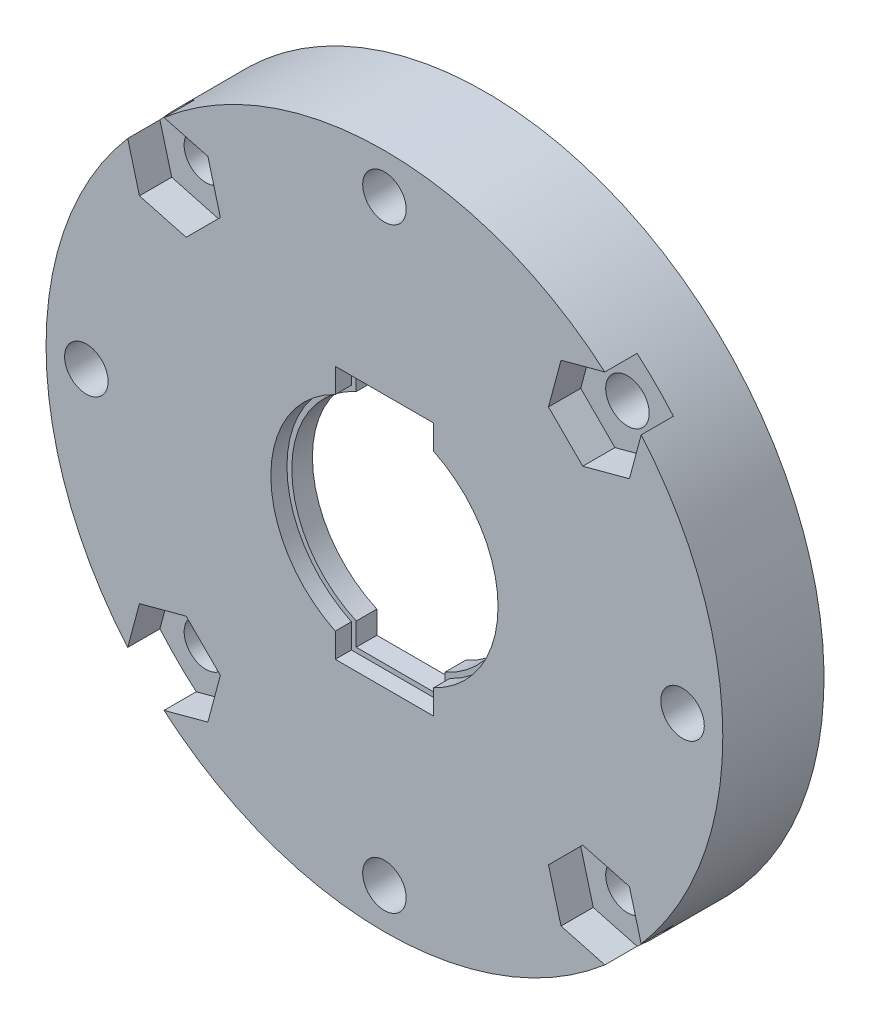
from build123d import *

# Parameters (mm, degrees)
SKETCH3_R           = 21
BOSS_EXTRUDE2_DEPTH = 1
SKETCH4_R           = 21
BOSS_EXTRUDE3_DEPTH = 5.28
SKETCH5_R           = 16.5
CUT_EXTRUDE1_DEPTH  = 4
CUT_EXTRUDE2_DEPTH  = 2
SKETCH8_R           = 1.35
CUT_EXTRUDE4_DEPTH  = 31.355203837
CIRPATTERN1_COUNT   = 4
CIRPATTERN2_COUNT   = 8


with BuildPart() as part:
    # Sketch3 → Boss-Extrude2 (new body)
    with BuildSketch(Plane.XY):
        Circle(SKETCH3_R)
        with BuildLine():
            Line((3.050012, 6.356093675), (3.050012, 7.874431))
            Line((3.050012, 7.874431), (-3.049988, 7.874431))
            Line((-3.049988, 7.874431), (-3.049988, 6.356105191))
            ThreePointArc((-3.049988, 6.356105191), (-7.05, 0), (-3.049988, -6.356105191))
            Line((-3.049988, -6.356105191), (-3.049988, -7.874679))
            Line((-3.049988, -7.874679), (3.050012, -7.874679))
            Line((3.050012, -7.874679), (3.050012, -6.356093675))
            ThreePointArc((3.050012, -6.356093675), (7.05, 0), (3.050012, 6.356093675))
        make_face(mode=Mode.SUBTRACT)
    extrude(amount=-BOSS_EXTRUDE2_DEPTH)

    # Sketch4 → Boss-Extrude3 (add)
    with BuildSketch(Plane(origin=(0, 0, -1), x_dir=(-1, 0, 0), z_dir=(0, 0, -1))):
        Circle(SKETCH4_R)
        with BuildLine():
            Line((2.749988, 6.164419356), (2.749988, 7.574431))
            Line((2.749988, 7.574431), (-2.750012, 7.574431))
            Line((-2.750012, 7.574431), (-2.750012, 6.16440865))
            ThreePointArc((-2.750012, 6.16440865), (-6.75, 0), (-2.750012, -6.16440865))
            Line((-2.750012, -6.16440865), (-2.750012, -7.574679))
            Line((-2.750012, -7.574679), (2.749988, -7.574679))
            Line((2.749988, -7.574679), (2.749988, -6.164419356))
            ThreePointArc((2.749988, -6.164419356), (6.75, 0), (2.749988, 6.164419356))
        make_face(mode=Mode.SUBTRACT)
    extrude(amount=BOSS_EXTRUDE3_DEPTH)

    # Sketch5 → Cut-Extrude1 (cut)
    with BuildSketch(Plane(origin=(0, 0, -6.28), x_dir=(-1, 0, 0), z_dir=(0, 0, -1))):
        Circle(SKETCH5_R)
    extrude(amount=-CUT_EXTRUDE1_DEPTH, mode=Mode.SUBTRACT)

    # Sketch6 → Cut-Extrude2 (cut)
    with BuildSketch(Plane.XY):
        Polygon((13.858507528, 15.981398638), (10.958584342, 15.204366562), (10.181552266, 12.304443376), (12.304443376, 10.181552266), (15.204366562, 10.958584342), (15.981398638, 13.858507528), align=None)
    cut_extrude2 = extrude(amount=-CUT_EXTRUDE2_DEPTH, mode=Mode.SUBTRACT)

    # Sketch8 → Cut-Extrude4 (cut, through all)
    with BuildSketch(Plane.XY):
        with Locations((13.081475452, 13.081475452)):
            Circle(SKETCH8_R)
    cut_extrude4 = extrude(amount=-CUT_EXTRUDE4_DEPTH, mode=Mode.SUBTRACT)

    # CirPattern1: Cut-Extrude2, Cut-Extrude4 ×4 about axis
    cirpattern1_axis = Axis((0, 0, -0.1), (0, 0, 1))
    add([cut_extrude2.rotate(cirpattern1_axis, i * 360 / CIRPATTERN1_COUNT) for i in range(1, CIRPATTERN1_COUNT)], mode=Mode.SUBTRACT)
    add([cut_extrude4.rotate(cirpattern1_axis, i * 360 / CIRPATTERN1_COUNT) for i in range(1, CIRPATTERN1_COUNT)], mode=Mode.SUBTRACT)

    # CirPattern2: Cut-Extrude4 ×8 about axis
    cirpattern2_axis = Axis((0, 0, -0.1), (0, 0, 1))
    for i in range(1, CIRPATTERN2_COUNT):
        add(cut_extrude4.rotate(cirpattern2_axis, i * 360 / CIRPATTERN2_COUNT), mode=Mode.SUBTRACT)


solid = part.part
